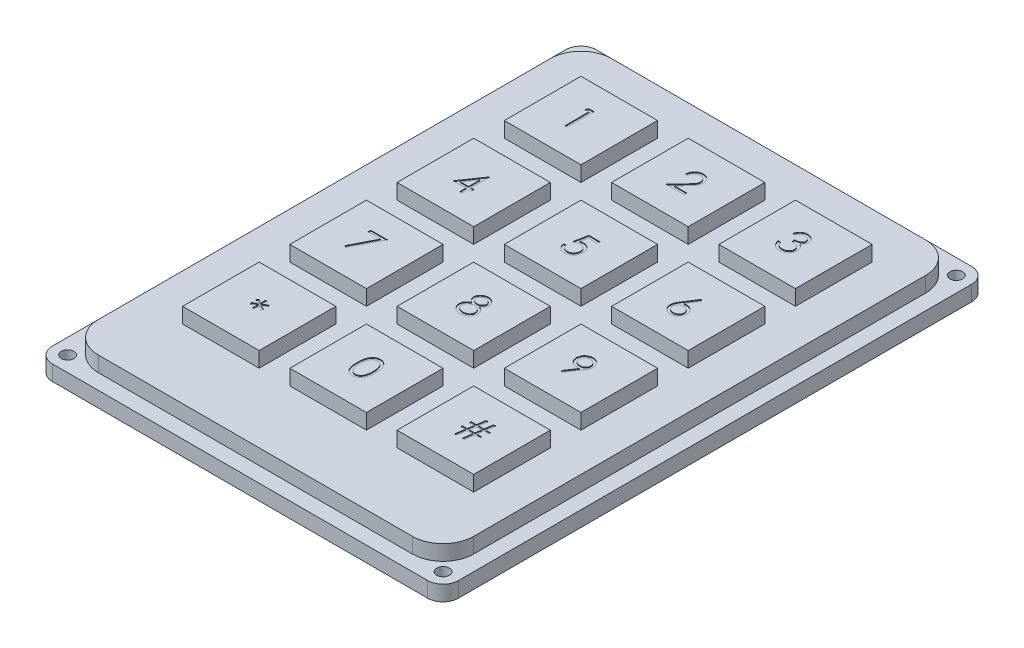
from build123d import *

# Parameters (mm, degrees)
SKETCH1_W               = 53
SKETCH1_H               = 71
BOSS_EXTRUDE1_DEPTH     = 2
FILLET1_R               = 2
SKETCH2_W               = 49
SKETCH2_H               = 67
BOSS_EXTRUDE2_DEPTH     = 2
FILLET2_R               = 4
SKETCH3_W               = 10
SKETCH3_H               = 10
KEY_DEPTH               = 2
KEYS_COUNT              = 3
KEYS_PITCH              = 14
KEYS_COUNT_DIR2         = 4
KEYS_PITCH_DIR2         = 14
SKETCH4_R               = 0.823323551
CUT_EXTRUDE1_DEPTH      = 45.480332733
MIRROR2_COPY_1_SKETCH_R = 0.823323551
MIRROR2_COPY_1_DEPTH    = 45.480332733
NUMBERS_DEPTH           = 0.1


with BuildPart() as part:
    # Sketch1 → Boss-Extrude1 (new body)
    with BuildSketch(Plane(origin=(0, 0, 0), x_dir=(1, 0, 0), z_dir=(0, 1, 0))):
        Rectangle(SKETCH1_W, SKETCH1_H)
    extrude(amount=BOSS_EXTRUDE1_DEPTH)

    # Fillet1
    fillet1_edges = [part.edges().sort_by_distance(p)[0] for p in [
        (-26.5, 1, -35.5),
        (26.5, 1, -35.5),
        (26.5, 1, 35.5),
        (-26.5, 1, 35.5),
    ]]
    fillet(fillet1_edges, radius=FILLET1_R)

    # Sketch2 → Boss-Extrude2 (add)
    with BuildSketch(Plane(origin=(0, 2, 0), x_dir=(1, 0, 0), z_dir=(0, 1, 0))):
        Rectangle(SKETCH2_W, SKETCH2_H)
    extrude(amount=BOSS_EXTRUDE2_DEPTH)

    # Fillet2
    fillet2_edges = [part.edges().sort_by_distance(p)[0] for p in [
        (24.5, 3, -33.5),
        (-24.5, 3, -33.5),
        (24.5, 3, 33.5),
        (-24.5, 3, 33.5),
    ]]
    fillet(fillet2_edges, radius=FILLET2_R)

    # Sketch3 → Key (add)
    with BuildSketch(Plane(origin=(0, 4, 0), x_dir=(1, 0, 0), z_dir=(0, 1, 0))):
        with Locations((-13.5, 22.5)):
            Rectangle(SKETCH3_W, SKETCH3_H)
    key = extrude(amount=KEY_DEPTH)

    # Keys: Key 3 × 4
    with Locations(*[(i * KEYS_PITCH, 0, j * KEYS_PITCH_DIR2) for i in range(KEYS_COUNT) for j in range(KEYS_COUNT_DIR2) if (i, j) != (0, 0)]):
        add(key)

    # Sketch4 → Cut-Extrude1 (cut, through all)
    with BuildSketch(Plane(origin=(0, 2, 0), x_dir=(1, 0, 0), z_dir=(0, 1, 0))):
        with Locations((-24.5, 33.5)):
            Circle(SKETCH4_R)
    cut_extrude1 = extrude(amount=-CUT_EXTRUDE1_DEPTH, mode=Mode.SUBTRACT)

    # Mirror1: Cut-Extrude1 across plane
    add(cut_extrude1.mirror(Plane(origin=(0, 0, 0), x_dir=(0, 0, 1), z_dir=(1, 0, 0))), mode=Mode.SUBTRACT)

    # Mirror2: Cut-Extrude1 across plane
    add(cut_extrude1.mirror(Plane.XY), mode=Mode.SUBTRACT)

    # Mirror2 copy 1 sketch → Mirror2 copy 1 (cut, through all)
    with BuildSketch(Plane(origin=(0, 2, 0), x_dir=(-1, 0, 0), z_dir=(0, 1, 0))):
        with Locations((-24.5, 33.5)):
            Circle(MIRROR2_COPY_1_SKETCH_R)
    extrude(amount=-MIRROR2_COPY_1_DEPTH, mode=Mode.SUBTRACT)

    # Sketch5 → Numbers (cut)
    # profile 1 of 12: a face of its own
    with BuildSketch(Plane(origin=(0, 6, 0), x_dir=(1, 0, 0), z_dir=(0, 1, 0))):
        Polygon((-14.289444186, 24.351344615), (-13.642308769, 24.351344615), (-13.642308769, 20.851344615), (-13.956411333, 20.851344615), (-13.956411333, 23.992370256), (-14.494872872, 23.992370256), align=None)
    # profile 2 of 12: a face of its own
    with BuildSketch(Plane(origin=(0, 6, 0), x_dir=(1, 0, 0), z_dir=(0, 1, 0))):
        with BuildLine():
            Line((-0.305734857, 23.274421538), (-0.619837421, 23.274421538))
            add(Edge.make_bspline(
                [(-0.619837421, 23.274421538), (-0.617790268, 23.316092426), (-0.613769714, 23.39793294), (-0.594941425, 23.517256847), (-0.568000547, 23.631311645), (-0.529909093, 23.739181559), (-0.482602816, 23.841820367), (-0.425872788, 23.938820382), (-0.358678938, 24.029811571), (-0.282472204, 24.113950414), (-0.199703565, 24.191137985), (-0.110397625, 24.257793228), (-0.016552598, 24.314110899), (0.081546801, 24.361192141), (0.185007365, 24.396531987), (0.292890223, 24.422753627), (0.405669359, 24.438529972), (0.482509381, 24.440225758), (0.521588861, 24.441088205)],
                knots=[0, 0, 0, 0, 1.10065271, 2.161652631, 3.183658789, 4.190468796, 5.17591951, 6.163126047, 7.15150782, 8.156236427, 9.156009102, 10.134482811, 11.092018607, 12.041330605, 13.001268258, 13.972401359, 14.968799086, 16, 16, 16, 16], degree=3))
            add(Edge.make_bspline(
                [(0.521588861, 24.441088205), (0.559966935, 24.440189748), (0.63537848, 24.438424313), (0.745440494, 24.423263284), (0.850217789, 24.399517693), (0.949505555, 24.366202276), (1.04251162, 24.321417849), (1.129934665, 24.26762031), (1.212815475, 24.205400479), (1.287422259, 24.132146665), (1.355930338, 24.053944281), (1.415032593, 23.970456377), (1.465645757, 23.884227092), (1.507833437, 23.79459889), (1.538889576, 23.700727862), (1.562467784, 23.603980659), (1.575795197, 23.503355848), (1.577840621, 23.435249292), (1.578880528, 23.400623461)],
                knots=[0, 0, 0, 0, 1.111607364, 2.184268762, 3.212621178, 4.221274766, 5.211760367, 6.196651075, 7.1921475, 8.207485113, 9.220403448, 10.201281604, 11.166441695, 12.114753415, 13.065576456, 14.026450734, 14.996634279, 16, 16, 16, 16], degree=3))
            add(Edge.make_bspline(
                [(1.578880528, 23.400623461), (1.577187265, 23.351875627), (1.573830454, 23.255235413), (1.545116077, 23.11322055), (1.500269566, 22.975627131), (1.446272209, 22.864889829), (1.391799765, 22.775656335), (1.342712258, 22.70218763), (1.285247446, 22.623082162), (1.218568949, 22.538604824), (1.144056076, 22.448093919), (1.061033913, 22.351604124), (0.968910431, 22.250132354), (0.90425193, 22.180826753), (0.870747515, 22.144914326)],
                knots=[0, 0, 0, 0, 1.184426356, 2.348067706, 3.509069118, 4.696110526, 5.333549288, 6.050745305, 6.844228056, 7.710549037, 8.667450064, 9.695053472, 10.805634456, 12, 12, 12, 12], degree=3))
            Line((0.870747515, 22.144914326), (-0.004953607, 21.210318974))
            Line((-0.004953607, 21.210318974), (1.623752323, 21.210318974))
            Line((1.623752323, 21.210318974), (1.623752323, 20.851344615))
            Line((1.623752323, 20.851344615), (-0.754452805, 20.851344615))
            Line((-0.754452805, 20.851344615), (0.602918989, 22.299862243))
            add(Edge.make_bspline(
                [(0.602918989, 22.299862243), (0.635966876, 22.33436055), (0.699445103, 22.400624736), (0.78922768, 22.497367696), (0.869866668, 22.587117237), (0.941884061, 22.669703786), (1.003717567, 22.746335353), (1.058589799, 22.814530057), (1.10255539, 22.877284507), (1.150270785, 22.950025121), (1.196484767, 23.038837438), (1.236197123, 23.147371128), (1.260411971, 23.25909838), (1.263316807, 23.334600417), (1.264777964, 23.372578589)],
                knots=[0, 0, 0, 0, 1.329631726, 2.553950428, 3.673215718, 4.687767853, 5.603093632, 6.413772471, 7.123043292, 7.734684054, 8.834405432, 9.900288307, 10.943827018, 12, 12, 12, 12], degree=3))
            add(Edge.make_bspline(
                [(1.264777964, 23.372578589), (1.264142221, 23.396459988), (1.262889295, 23.443525638), (1.251831598, 23.512531397), (1.235121092, 23.579096211), (1.211175834, 23.64342483), (1.179569094, 23.704870482), (1.141095714, 23.763507962), (1.09670565, 23.820196927), (1.045354381, 23.873350226), (0.988942861, 23.922031431), (0.929348612, 23.965155516), (0.866298507, 24.001194627), (0.800058385, 24.030738124), (0.730812916, 24.053913506), (0.658428171, 24.069972085), (0.583104154, 24.080054569), (0.531670659, 24.081418741), (0.50546306, 24.082113846)],
                knots=[0, 0, 0, 0, 0.991446411, 1.95395049, 2.89581595, 3.838931463, 4.798493298, 5.75982156, 6.748411868, 7.785213223, 8.824556874, 9.840280684, 10.836137867, 11.835679398, 12.848801643, 13.863922112, 14.911575587, 16, 16, 16, 16], degree=3))
            add(Edge.make_bspline(
                [(0.50546306, 24.082113846), (0.478092227, 24.081398813), (0.424340431, 24.079994608), (0.345421398, 24.070171944), (0.27013562, 24.053226104), (0.198293718, 24.030049429), (0.129774132, 24.000590881), (0.064910088, 23.963899136), (0.003847198, 23.920115643), (-0.053529325, 23.870475086), (-0.106393304, 23.815207485), (-0.15284018, 23.753597522), (-0.193424194, 23.686770107), (-0.228833427, 23.614905556), (-0.257589118, 23.537351776), (-0.279562268, 23.454384071), (-0.296949115, 23.36636269), (-0.302757635, 23.305577605), (-0.305734857, 23.274421538)],
                knots=[0, 0, 0, 0, 1.031018746, 2.02475058, 2.990194455, 3.934040569, 4.864654155, 5.795059489, 6.735614925, 7.690564532, 8.649604399, 9.611025574, 10.590972636, 11.591080095, 12.624614302, 13.701020113, 14.821632451, 16, 16, 16, 16], degree=3))
        make_face()
    # profile 3 of 12: a face of its own
    with BuildSketch(Plane(origin=(0, 6, 0), x_dir=(1, 0, 0), z_dir=(0, 1, 0))):
        with BuildLine():
            Line((13.410526912, 23.543652307), (13.096424348, 23.543652307))
            add(Edge.make_bspline(
                [(13.096424348, 23.543652307), (13.104933899, 23.578884791), (13.121569374, 23.647761416), (13.156266948, 23.746168676), (13.194066203, 23.839292198), (13.239455308, 23.925388272), (13.288964062, 24.006187174), (13.345686783, 24.079856299), (13.407006506, 24.148269264), (13.474831455, 24.208982502), (13.545960117, 24.263960231), (13.621394737, 24.310835288), (13.69961763, 24.351159441), (13.781170763, 24.384379673), (13.866296935, 24.409405197), (13.954226558, 24.427562002), (14.045190058, 24.439353117), (14.106937649, 24.44050388), (14.138291335, 24.441088205)],
                knots=[0, 0, 0, 0, 1.162005537, 2.271625781, 3.343758855, 4.383309926, 5.390229558, 6.379919256, 7.361854164, 8.333198761, 9.295911338, 10.242430842, 11.177959212, 12.116337295, 13.062827104, 14.020064771, 14.994644689, 16, 16, 16, 16], degree=3))
            add(Edge.make_bspline(
                [(14.138291335, 24.441088205), (14.183974077, 24.439708974), (14.274343088, 24.436980599), (14.407106135, 24.412066162), (14.535132954, 24.37264103), (14.657022202, 24.318167303), (14.770240635, 24.25097999), (14.870976822, 24.171015253), (14.957865332, 24.079815951), (15.03075971, 23.979083387), (15.087834709, 23.871427878), (15.129921083, 23.760627721), (15.155542764, 23.646945749), (15.15886332, 23.57018847), (15.160526912, 23.531733237)],
                knots=[0, 0, 0, 0, 1.083050992, 2.142477498, 3.193116406, 4.255571735, 5.30263384, 6.308962982, 7.297363603, 8.282367274, 9.249857812, 10.179914175, 11.08814088, 12, 12, 12, 12], degree=3))
            add(Edge.make_bspline(
                [(15.160526912, 23.531733237), (15.159363321, 23.494726442), (15.157086354, 23.422309888), (15.137752648, 23.31658839), (15.105216386, 23.21694679), (15.060146623, 23.122965628), (15.001805073, 23.035240788), (14.931132376, 22.953574897), (14.847629714, 22.877605739), (14.784350776, 22.834086266), (14.751772906, 22.811681153)],
                knots=[0, 0, 0, 0, 1.024540389, 2.004866551, 2.965041327, 3.920577974, 4.882998113, 5.874504559, 6.905732034, 8, 8, 8, 8], degree=3))
            add(Edge.make_bspline(
                [(14.751772906, 22.811681153), (14.78900466, 22.793702982), (14.862771535, 22.758083024), (14.963322064, 22.688227267), (15.05459994, 22.607570919), (15.105503659, 22.544628266), (15.131079797, 22.513003269)],
                knots=[0, 0, 0, 0, 1.015518401, 2.012035669, 3.001164323, 4, 4, 4, 4], degree=3))
            add(Edge.make_bspline(
                [(15.131079797, 22.513003269), (15.147921139, 22.489945517), (15.181328035, 22.444207601), (15.222563569, 22.370671175), (15.259972683, 22.296319685), (15.289122903, 22.219160279), (15.311696769, 22.140087266), (15.327832802, 22.05896487), (15.337856943, 21.975726847), (15.339292495, 21.919414367), (15.340014092, 21.891108237)],
                knots=[0, 0, 0, 0, 1.025084078, 2.033381695, 3.024893161, 4.013698104, 4.991890475, 5.976764909, 6.982997093, 8, 8, 8, 8], degree=3))
            add(Edge.make_bspline(
                [(15.340014092, 21.891108237), (15.338219578, 21.842098516), (15.334638996, 21.744309714), (15.302634922, 21.599834992), (15.253021681, 21.45860949), (15.182564745, 21.323534651), (15.096697236, 21.19715427), (14.994539912, 21.084077961), (14.877253504, 20.986879356), (14.746447855, 20.905669128), (14.604730726, 20.840751206), (14.453155134, 20.795693763), (14.29390508, 20.766347763), (14.184697783, 20.763200895), (14.129176752, 20.761601025)],
                knots=[0, 0, 0, 0, 0.955779014, 1.907060117, 2.875433937, 3.871313158, 4.872415639, 5.851225146, 6.836215519, 7.83643374, 8.849228613, 9.86973379, 10.916971861, 12, 12, 12, 12], degree=3))
            add(Edge.make_bspline(
                [(14.129176752, 20.761601025), (14.091757452, 20.762469238), (14.018128747, 20.764177593), (13.909885248, 20.775856194), (13.806563549, 20.797186199), (13.708023951, 20.825889504), (13.614178915, 20.862281247), (13.525314809, 20.907599945), (13.440884916, 20.960911447), (13.361685965, 21.022845034), (13.287727397, 21.092126374), (13.220974673, 21.169985384), (13.16031488, 21.254982788), (13.107372241, 21.348105844), (13.059735289, 21.448151102), (13.020554332, 21.5563996), (12.986068763, 21.671883622), (12.970035299, 21.752361362), (12.961808964, 21.793652307)],
                knots=[0, 0, 0, 0, 1.048658725, 2.063410685, 3.046034179, 4.001477787, 4.936774919, 5.862367409, 6.792675028, 7.730719943, 8.675894397, 9.627829632, 10.600096036, 11.597688215, 12.626045268, 13.701542398, 14.82072376, 16, 16, 16, 16], degree=3))
            Line((12.961808964, 21.793652307), (13.275911528, 21.793652307))
            add(Edge.make_bspline(
                [(13.275911528, 21.793652307), (13.284094819, 21.766703294), (13.300012032, 21.714285122), (13.32710633, 21.638844817), (13.357974602, 21.569686763), (13.39108916, 21.506303641), (13.425867606, 21.448071239), (13.464782532, 21.39652937), (13.504951677, 21.349414168), (13.53523103, 21.322869556), (13.550050149, 21.309878269)],
                knots=[0, 0, 0, 0, 1.198163088, 2.33053128, 3.407730985, 4.417276592, 5.372219308, 6.28897303, 7.162600585, 8, 8, 8, 8], degree=3))
            add(Edge.make_bspline(
                [(13.550050149, 21.309878269), (13.569646726, 21.294769935), (13.608779389, 21.264599903), (13.67254762, 21.226098275), (13.739612506, 21.192737249), (13.81142718, 21.167253554), (13.886441951, 21.145675893), (13.965869316, 21.131555374), (14.049008533, 21.121867202), (14.105776296, 21.121012271), (14.134785726, 21.120575384)],
                knots=[0, 0, 0, 0, 0.946170439, 1.889420265, 2.845303464, 3.807233317, 4.801018734, 5.828864929, 6.890507805, 8, 8, 8, 8], degree=3))
            add(Edge.make_bspline(
                [(14.134785726, 21.120575384), (14.167539229, 21.121191289), (14.231585876, 21.122395639), (14.325040735, 21.133471346), (14.413948183, 21.149601759), (14.497321109, 21.174514742), (14.576251616, 21.205295594), (14.649633266, 21.243943999), (14.718429372, 21.289288721), (14.781758777, 21.340827879), (14.838704285, 21.397249374), (14.888843798, 21.456262445), (14.931468459, 21.517618275), (14.965852038, 21.581656396), (14.993002588, 21.648111625), (15.011485788, 21.717170454), (15.024337304, 21.78826772), (15.025383916, 21.836596689), (15.025911528, 21.86096)],
                knots=[0, 0, 0, 0, 1.217147791, 2.380027433, 3.494444702, 4.572153297, 5.609568379, 6.639424714, 7.649109417, 8.668170816, 9.669597737, 10.625200337, 11.543417969, 12.441394052, 13.322311151, 14.205496177, 15.095365482, 16, 16, 16, 16], degree=3))
            add(Edge.make_bspline(
                [(15.025911528, 21.86096), (15.024381226, 21.893571338), (15.021328238, 21.958631747), (14.998019658, 22.054349321), (14.959680794, 22.146572733), (14.906008283, 22.233728523), (14.840672554, 22.314504425), (14.764307647, 22.386575907), (14.676279419, 22.446045999), (14.59525955, 22.487134655), (14.523494393, 22.51517173), (14.462079009, 22.533846695), (14.393322405, 22.54966035), (14.318056057, 22.564372622), (14.23571284, 22.57689397), (14.146382402, 22.587335786), (14.05004664, 22.595690827), (13.983355475, 22.599421922), (13.948988451, 22.601344615)],
                knots=[0, 0, 0, 0, 1.07054697, 2.135767047, 3.216561865, 4.33974944, 5.486079747, 6.621378074, 7.775625952, 8.963672916, 9.598146892, 10.304877434, 11.070270905, 11.915000392, 12.823868403, 13.805723172, 14.86925407, 16, 16, 16, 16], degree=3))
            Line((13.948988451, 22.601344615), (13.948988451, 22.960318974))
            add(Edge.make_bspline(
                [(13.948988451, 22.960318974), (13.992289616, 22.961053778), (14.077105963, 22.962493078), (14.201000268, 22.979901088), (14.31947358, 23.003981716), (14.429900322, 23.040866908), (14.530549035, 23.083707205), (14.617868637, 23.133559415), (14.690635785, 23.188974164), (14.748496856, 23.250806773), (14.792026085, 23.317121821), (14.823852882, 23.386238478), (14.842653208, 23.458762539), (14.845162875, 23.508257207), (14.846424348, 23.53313548)],
                knots=[0, 0, 0, 0, 1.321986639, 2.589447074, 3.816329219, 5.01088745, 6.139805852, 7.153945165, 8.075214402, 8.924034688, 9.728124013, 10.488707548, 11.240355623, 12, 12, 12, 12], degree=3))
            add(Edge.make_bspline(
                [(14.846424348, 23.53313548), (14.846009937, 23.551413225), (14.845185486, 23.587775933), (14.834788208, 23.640901001), (14.819164167, 23.692401947), (14.797684438, 23.742059757), (14.768934239, 23.789530031), (14.734528253, 23.83521748), (14.693560153, 23.878861259), (14.646614706, 23.919541579), (14.596202901, 23.958310816), (14.540953126, 23.991224453), (14.482531251, 24.019369515), (14.420872596, 24.042579017), (14.355777066, 24.060038305), (14.287550508, 24.072574147), (14.216062825, 24.080411802), (14.167291093, 24.081540217), (14.142498066, 24.082113846)],
                knots=[0, 0, 0, 0, 0.884392785, 1.759457502, 2.611959086, 3.489218968, 4.37281399, 5.2945488, 6.255912374, 7.266815255, 8.301784654, 9.332968512, 10.37626691, 11.440494194, 12.520033166, 13.637162961, 14.798855837, 16, 16, 16, 16], degree=3))
            add(Edge.make_bspline(
                [(14.142498066, 24.082113846), (14.102646398, 24.080722484), (14.024806822, 24.07800483), (13.912591905, 24.054201817), (13.808272571, 24.016223733), (13.728533904, 23.970890714), (13.66965133, 23.92614028), (13.627574392, 23.887057894), (13.586253881, 23.84362507), (13.548408205, 23.793166695), (13.510134228, 23.739099904), (13.475289666, 23.678676223), (13.441429974, 23.613471829), (13.421027424, 23.567376194), (13.410526912, 23.543652307)],
                knots=[0, 0, 0, 0, 1.472543308, 2.876219568, 4.221790263, 5.565193594, 6.249813518, 6.953379497, 7.687249741, 8.463570142, 9.283606569, 10.136032583, 11.040678096, 12, 12, 12, 12], degree=3))
        make_face()
    # profile 4 of 12: a face of its own
    with BuildSketch(Plane(origin=(0, 6, 0), x_dir=(1, 0, 0), z_dir=(0, 1, 0))):
        Polygon((-13.122777519, 10.130049298), (-13.058975436, 10.130049298), (-13.058975436, 7.706972375), (-12.655129282, 7.706972375), (-12.655129282, 7.347998016), (-13.058975436, 7.347998016), (-13.058975436, 6.540305708), (-13.373078, 6.540305708), (-13.373078, 7.347998016), (-15.03333441, 7.347998016), align=None)
        Polygon((-13.373078, 7.706972375), (-13.373078, 9.227004426), (-14.416347231, 7.706972375), align=None, mode=Mode.SUBTRACT)
    # profile 5 of 12: a face of its own
    with BuildSketch(Plane(origin=(0, 6, 0), x_dir=(1, 0, 0), z_dir=(0, 1, 0))):
        with BuildLine():
            Line((1.444265143, 10.040305708), (1.444265143, 9.681331349))
            Line((1.444265143, 9.681331349), (0.253760336, 9.681331349))
            Line((0.253760336, 9.681331349), (0.065158573, 8.760758432))
            add(Edge.make_bspline(
                [(0.065158573, 8.760758432), (0.102214447, 8.770988704), (0.174004343, 8.790808238), (0.279964204, 8.812814008), (0.380556407, 8.826079452), (0.445831778, 8.827890763), (0.477418188, 8.828767246)],
                knots=[0, 0, 0, 0, 1.100273476, 2.13160584, 3.095893838, 4, 4, 4, 4], degree=3))
            add(Edge.make_bspline(
                [(0.477418188, 8.828767246), (0.516501928, 8.827921311), (0.593350325, 8.82625799), (0.705789272, 8.81028614), (0.813122165, 8.785146226), (0.915124536, 8.750025704), (1.011985086, 8.705115971), (1.102812648, 8.64901603), (1.188970561, 8.583482699), (1.268913155, 8.508137687), (1.341437463, 8.425216071), (1.405203452, 8.3360582), (1.459366043, 8.241530537), (1.502926798, 8.140729929), (1.537711132, 8.034770775), (1.560863127, 7.922538193), (1.576279836, 7.805090073), (1.578002222, 7.724785503), (1.578880528, 7.683835355)],
                knots=[0, 0, 0, 0, 1.052922333, 2.070308379, 3.05430497, 4.020497103, 4.973039431, 5.925935799, 6.892292201, 7.88610001, 8.88166317, 9.857072816, 10.836096531, 11.812156883, 12.81219415, 13.836441305, 14.89672472, 16, 16, 16, 16], degree=3))
            add(Edge.make_bspline(
                [(1.578880528, 7.683835355), (1.578215453, 7.655313135), (1.57689429, 7.598654148), (1.570175702, 7.514509947), (1.557239986, 7.432147114), (1.539872262, 7.351554722), (1.517329844, 7.27288535), (1.49004079, 7.195913822), (1.456644763, 7.121119215), (1.420013388, 7.04779382), (1.378766909, 6.977595313), (1.332988402, 6.911946326), (1.284622911, 6.849862045), (1.232581525, 6.792008312), (1.17638053, 6.738765294), (1.116700563, 6.689817012), (1.054017844, 6.644335682), (0.987362602, 6.604167487), (0.918220119, 6.567204531), (0.845591902, 6.536880993), (0.771131202, 6.509770465), (0.693766326, 6.488160938), (0.613672513, 6.471228383), (0.530717738, 6.459727783), (0.445337068, 6.451351345), (0.387462055, 6.450826988), (0.358227483, 6.450562118)],
                knots=[0, 0, 0, 0, 1.056347294, 2.098418968, 3.122841568, 4.141288669, 5.149314143, 6.15115421, 7.162517403, 8.180376062, 9.185164535, 10.17417709, 11.141909838, 12.097768115, 13.052685741, 14.0056014, 14.954263652, 15.917497458, 16.885230207, 17.854509472, 18.828990115, 19.81800267, 20.826176721, 21.857883937, 22.917946725, 24, 24, 24, 24], degree=3))
            add(Edge.make_bspline(
                [(0.358227483, 6.450562118), (0.323353302, 6.451252956), (0.254742472, 6.452612098), (0.154221905, 6.466830584), (0.057507299, 6.4871945), (-0.034622802, 6.51783077), (-0.122994066, 6.556218065), (-0.206416784, 6.604734236), (-0.28702256, 6.65971334), (-0.361534597, 6.724593693), (-0.43069071, 6.795509375), (-0.492597219, 6.872467016), (-0.547730796, 6.954196458), (-0.595208543, 7.041094612), (-0.635706564, 7.132933143), (-0.667521552, 7.230056144), (-0.693199907, 7.331956148), (-0.704063328, 7.402109658), (-0.709581011, 7.437741605)],
                knots=[0, 0, 0, 0, 1.0467383, 2.05933395, 3.04377827, 4.011590433, 4.970194871, 5.932262533, 6.905835911, 7.896367577, 8.894135286, 9.877477877, 10.858688626, 11.851381753, 12.8477658, 13.868841284, 14.917554742, 16, 16, 16, 16], degree=3))
            Line((-0.709581011, 7.437741605), (-0.395478446, 7.437741605))
            add(Edge.make_bspline(
                [(-0.395478446, 7.437741605), (-0.387749889, 7.404365153), (-0.372895173, 7.340213758), (-0.340289424, 7.250082417), (-0.300423548, 7.169763193), (-0.2530192, 7.09819361), (-0.19646917, 7.035784613), (-0.131939741, 6.980167551), (-0.059592017, 6.929992421), (0.020801212, 6.888169654), (0.105614291, 6.852500901), (0.194381501, 6.828749206), (0.284685848, 6.812048313), (0.345764218, 6.810376552), (0.37645665, 6.809536477)],
                knots=[0, 0, 0, 0, 1.136247022, 2.183929868, 3.172523383, 4.106158343, 5.02341133, 5.958108904, 6.928429099, 7.938127109, 8.96079061, 9.975095812, 10.982467395, 12, 12, 12, 12], degree=3))
            add(Edge.make_bspline(
                [(0.37645665, 6.809536477), (0.406415094, 6.810357255), (0.465403516, 6.811973374), (0.552214903, 6.824412386), (0.636027777, 6.843569957), (0.716015134, 6.872239812), (0.793576674, 6.90708453), (0.866750444, 6.951799606), (0.937653321, 7.003259625), (1.004081455, 7.062216255), (1.064920904, 7.127185949), (1.118677025, 7.196663343), (1.163453938, 7.270780189), (1.201188047, 7.348253342), (1.229841346, 7.429931899), (1.250282327, 7.515433074), (1.262285386, 7.604968055), (1.263936566, 7.666037364), (1.264777964, 7.69715667)],
                knots=[0, 0, 0, 0, 1.027316725, 2.022795036, 3.002884548, 3.971462791, 4.93288096, 5.914575861, 6.907176829, 7.935150275, 8.956128384, 9.956726525, 10.942570165, 11.921478529, 12.907843606, 13.90538589, 14.932640048, 16, 16, 16, 16], degree=3))
            add(Edge.make_bspline(
                [(1.264777964, 7.69715667), (1.264119484, 7.725232421), (1.262830604, 7.78018671), (1.252300034, 7.860585917), (1.233983062, 7.936658959), (1.208559182, 8.008773193), (1.176279674, 8.076996635), (1.136833362, 8.141399695), (1.089479964, 8.201133529), (1.035388075, 8.256226082), (0.976130034, 8.307070957), (0.910686292, 8.350415044), (0.840426365, 8.386878961), (0.766196765, 8.41834696), (0.686231867, 8.440947705), (0.602115234, 8.45791559), (0.512938527, 8.467730953), (0.451967838, 8.469092842), (0.420627323, 8.469792887)],
                knots=[0, 0, 0, 0, 1.045622112, 2.046656509, 3.013763289, 3.955457236, 4.890082067, 5.820317437, 6.762574623, 7.722996705, 8.69280354, 9.665887285, 10.63943826, 11.638615906, 12.663482002, 13.728887084, 14.832589034, 16, 16, 16, 16], degree=3))
            add(Edge.make_bspline(
                [(0.420627323, 8.469792887), (0.393498394, 8.469212296), (0.337484039, 8.468013523), (0.251561212, 8.459187026), (0.161269489, 8.444947732), (0.066954993, 8.425361484), (-0.031665515, 8.399730407), (-0.134383915, 8.369015907), (-0.241416182, 8.332293908), (-0.313533906, 8.304561694), (-0.350606652, 8.290305708)],
                knots=[0, 0, 0, 0, 0.817624296, 1.688186739, 2.600797293, 3.572016777, 4.590301741, 5.671205678, 6.80286297, 8, 8, 8, 8], degree=3))
            Line((-0.350606652, 8.290305708), (0.008367707, 10.040305708))
            Line((0.008367707, 10.040305708), (1.444265143, 10.040305708))
        make_face()
    # profile 6 of 12: a face of its own
    with BuildSketch(Plane(origin=(0, 6, 0), x_dir=(1, 0, 0), z_dir=(0, 1, 0))):
        with BuildLine():
            Line((14.577193579, 10.130049298), (14.819080598, 9.940045291))
            Line((14.819080598, 9.940045291), (13.894300951, 8.525882631))
            add(Edge.make_bspline(
                [(13.894300951, 8.525882631), (13.955871228, 8.535696492), (14.075971014, 8.554839537), (14.197536913, 8.557997482), (14.256780919, 8.559536477)],
                knots=[0, 0, 0, 0, 1.025318673, 2, 2, 2, 2], degree=3))
            add(Edge.make_bspline(
                [(14.256780919, 8.559536477), (14.292353415, 8.558580366), (14.362376815, 8.556698288), (14.465183618, 8.542214437), (14.563972554, 8.519389326), (14.658334166, 8.48611707), (14.748607148, 8.443614715), (14.835309544, 8.392675845), (14.916811554, 8.330670165), (14.994162733, 8.261405209), (15.064389831, 8.184688224), (15.126565886, 8.103286888), (15.178792678, 8.017286007), (15.221166599, 7.926729141), (15.254071478, 7.831755881), (15.278059123, 7.732487742), (15.292238716, 7.62885627), (15.294164207, 7.558378095), (15.295142297, 7.522577343)],
                knots=[0, 0, 0, 0, 1.04369286, 2.054478336, 3.041073146, 4.015093852, 4.984733326, 5.965804835, 6.960378782, 7.985147595, 9.009457201, 10.008161701, 10.986880575, 11.956520048, 12.937015923, 13.931873656, 14.949455224, 16, 16, 16, 16], degree=3))
            add(Edge.make_bspline(
                [(15.295142297, 7.522577343), (15.293719192, 7.473597639), (15.290918858, 7.377217173), (15.263015062, 7.236840466), (15.219655418, 7.103107951), (15.157677889, 6.978154779), (15.080695506, 6.86215221), (14.986817913, 6.759366744), (14.879374425, 6.667696707), (14.757887627, 6.591040088), (14.627144663, 6.528437037), (14.489792665, 6.483471795), (14.347165519, 6.455788325), (14.250360911, 6.452317723), (14.201392297, 6.450562118)],
                knots=[0, 0, 0, 0, 1.031375318, 2.029502543, 3.004789286, 3.987476834, 4.960371455, 5.9300674, 6.912260825, 7.929083631, 8.949397511, 9.960523116, 10.96833055, 12, 12, 12, 12], degree=3))
            add(Edge.make_bspline(
                [(14.201392297, 6.450562118), (14.154295596, 6.452090324), (14.061005278, 6.455117432), (13.923772484, 6.48208337), (13.791909467, 6.525790473), (13.666340086, 6.586004751), (13.550019473, 6.662062634), (13.445953836, 6.753624913), (13.354662062, 6.858734378), (13.278687441, 6.977374726), (13.218428709, 7.104864683), (13.173238784, 7.23780184), (13.146842541, 7.375701821), (13.143153984, 7.46918296), (13.141296143, 7.516267246)],
                knots=[0, 0, 0, 0, 1.012016664, 2.004627821, 2.994792927, 3.992885782, 4.990978636, 5.973936114, 6.964471063, 7.975201453, 8.993600317, 9.990122807, 10.98767138, 12, 12, 12, 12], degree=3))
            add(Edge.make_bspline(
                [(13.141296143, 7.516267246), (13.142477588, 7.55231183), (13.144889873, 7.625907982), (13.161733263, 7.73737201), (13.188798058, 7.851423091), (13.219108304, 7.948177285), (13.251133914, 8.027438807), (13.277786454, 8.091342298), (13.31096045, 8.157103371), (13.346333831, 8.226977007), (13.3870907, 8.299162439), (13.43140635, 8.374866109), (13.480506001, 8.452884037), (13.514926163, 8.505828232), (13.532522105, 8.532893849)],
                knots=[0, 0, 0, 0, 1.173818275, 2.396712641, 3.66331629, 4.989737886, 5.693666774, 6.447286557, 7.243889047, 8.091586357, 8.998013824, 9.943181721, 10.948533338, 12, 12, 12, 12], degree=3))
            Line((13.532522105, 8.532893849), (14.577193579, 10.130049298))
        make_face()
        with BuildLine():
            add(Edge.make_bspline(
                [(14.19087547, 8.200562118), (14.164213225, 8.199784075), (14.112134116, 8.198264329), (14.035726701, 8.189439077), (13.96341345, 8.172820012), (13.894236316, 8.15165368), (13.829488613, 8.12255062), (13.768699773, 8.087198821), (13.711634721, 8.045577643), (13.658891169, 7.998276732), (13.611071506, 7.946488699), (13.569890375, 7.891019177), (13.534367975, 7.833204974), (13.505486156, 7.772563031), (13.482996081, 7.709116532), (13.46672783, 7.643157282), (13.457674079, 7.574242976), (13.456167847, 7.527510474), (13.455398707, 7.503647054)],
                knots=[0, 0, 0, 0, 1.129588631, 2.206414736, 3.251139165, 4.268635594, 5.265702196, 6.250456724, 7.242448911, 8.251968645, 9.246821453, 10.222880186, 11.173611482, 12.116736599, 13.062300278, 14.020270554, 14.989073742, 16, 16, 16, 16], degree=3))
            add(Edge.make_bspline(
                [(13.455398707, 7.503647054), (13.456025069, 7.479997074), (13.45725327, 7.433622985), (13.46840559, 7.365283805), (13.485440672, 7.299518897), (13.510781068, 7.236667298), (13.541007956, 7.17577098), (13.580913281, 7.119035694), (13.625130066, 7.063015624), (13.677984, 7.012014153), (13.734707363, 6.964557529), (13.795308565, 6.923077275), (13.858468525, 6.887591102), (13.925039947, 6.859780004), (13.994078331, 6.836955717), (14.066158885, 6.820894238), (14.141331741, 6.811813712), (14.192253679, 6.810305518), (14.21821922, 6.809536477)],
                knots=[0, 0, 0, 0, 0.989467248, 1.94019797, 2.891935182, 3.827694429, 4.772920941, 5.730924762, 6.725747692, 7.756678648, 8.79901574, 9.819492441, 10.826891316, 11.826466727, 12.835195252, 13.867842842, 14.912794438, 16, 16, 16, 16], degree=3))
            add(Edge.make_bspline(
                [(14.21821922, 6.809536477), (14.244184718, 6.810305579), (14.295106573, 6.81181389), (14.370280033, 6.820893559), (14.442358352, 6.836958207), (14.51140486, 6.859770978), (14.577946292, 6.887624587), (14.641051013, 6.922856507), (14.701079107, 6.964812625), (14.757839706, 7.011933053), (14.810473644, 7.063305905), (14.855750923, 7.118535627), (14.894434157, 7.176229523), (14.925868344, 7.236427412), (14.950929635, 7.2995569), (14.968051102, 7.365273624), (14.979180391, 7.43362565), (14.980411757, 7.479997974), (14.981039733, 7.503647054)],
                knots=[0, 0, 0, 0, 1.087397944, 2.132534446, 3.165364764, 4.174271784, 5.174024072, 6.181601208, 7.194203697, 8.236725232, 9.267838612, 10.269026844, 11.221737037, 12.171628256, 13.107553087, 14.05945871, 15.010357665, 16, 16, 16, 16], degree=3))
            add(Edge.make_bspline(
                [(14.981039733, 7.503647054), (14.98048944, 7.527541605), (14.979409394, 7.574438838), (14.967193445, 7.643126456), (14.950251071, 7.709451662), (14.92466804, 7.772997611), (14.891431496, 7.833513538), (14.850948089, 7.891305139), (14.804115518, 7.946815487), (14.750017979, 7.998378295), (14.691127745, 8.045525373), (14.628512159, 8.087144929), (14.563004186, 8.122269906), (14.494670243, 8.151577008), (14.422727361, 8.172726482), (14.348337021, 8.189379725), (14.270547779, 8.198241743), (14.21777117, 8.199778808), (14.19087547, 8.200562118)],
                knots=[0, 0, 0, 0, 0.978206639, 1.919901502, 2.851605144, 3.780102724, 4.718870031, 5.675451981, 6.667674623, 7.690630536, 8.733308323, 9.756129687, 10.767539656, 11.776269907, 12.797430371, 13.836405707, 14.897401972, 16, 16, 16, 16], degree=3))
        make_face(mode=Mode.SUBTRACT)
    # profile 7 of 12: a face of its own
    with BuildSketch(Plane(origin=(0, 6, 0), x_dir=(1, 0, 0), z_dir=(0, 1, 0))):
        Polygon((-14.808975436, -3.613546793), (-12.655129282, -3.613546793), (-14.494872872, -7.203290383), (-14.766207006, -7.053951441), (-13.186579603, -3.972521152), (-14.808975436, -3.972521152), align=None)
    # profile 8 of 12: a face of its own
    with BuildSketch(Plane(origin=(0, 6, 0), x_dir=(1, 0, 0), z_dir=(0, 1, 0))):
        with BuildLine():
            add(Edge.make_bspline(
                [(0.947169791, -5.163727082), (0.975818338, -5.178665037), (1.031692572, -5.20779904), (1.111269781, -5.254709868), (1.183994782, -5.304150833), (1.251885344, -5.353786692), (1.313748695, -5.405518344), (1.368893107, -5.4595515), (1.418680727, -5.514537445), (1.462107511, -5.571407285), (1.500304348, -5.630009935), (1.533316483, -5.690499208), (1.561533686, -5.752742541), (1.583896625, -5.817419371), (1.602318416, -5.883579633), (1.614994021, -5.952077615), (1.621810939, -6.022461956), (1.623099753, -6.070030257), (1.623752323, -6.094115703)],
                knots=[0, 0, 0, 0, 1.272397273, 2.481599622, 3.635517121, 4.734568067, 5.792894095, 6.808321871, 7.773003508, 8.711915296, 9.623354172, 10.525449501, 11.423591555, 12.311487226, 13.218079475, 14.126165749, 15.051214107, 16, 16, 16, 16], degree=3))
            add(Edge.make_bspline(
                [(1.623752323, -6.094115703), (1.622980902, -6.127813436), (1.621453972, -6.194513893), (1.608153987, -6.292960004), (1.588241009, -6.388571786), (1.559161497, -6.481328277), (1.521448106, -6.57071765), (1.47497127, -6.656816424), (1.422360065, -6.741035733), (1.380107826, -6.792855135), (1.358728284, -6.819075639)],
                knots=[0, 0, 0, 0, 1.025265484, 2.029385089, 3.018602448, 3.995076438, 4.983346944, 5.966715145, 6.97116228, 8, 8, 8, 8], degree=3))
            add(Edge.make_bspline(
                [(1.358728284, -6.819075639), (1.33089181, -6.849669413), (1.275562844, -6.910478906), (1.180779917, -6.989429716), (1.076758033, -7.05577911), (0.9638997, -7.109851005), (0.842506599, -7.151936864), (0.712604594, -7.182179382), (0.573940441, -7.199501811), (0.47863497, -7.2020058), (0.429741906, -7.203290383)],
                knots=[0, 0, 0, 0, 0.954267603, 1.896743057, 2.838368354, 3.796610408, 4.779680527, 5.799409237, 6.871065594, 8, 8, 8, 8], degree=3))
            add(Edge.make_bspline(
                [(0.429741906, -7.203290383), (0.382728517, -7.202137905), (0.291245238, -7.1998953), (0.158087361, -7.184700868), (0.033964291, -7.158073002), (-0.081845677, -7.121628392), (-0.188644371, -7.074218164), (-0.286127472, -7.015209755), (-0.375701444, -6.946978313), (-0.454647918, -6.867564235), (-0.524736361, -6.782506363), (-0.586304414, -6.694754753), (-0.637478493, -6.604301395), (-0.680805588, -6.512495028), (-0.713973611, -6.418048874), (-0.736945821, -6.321448861), (-0.751535135, -6.222863718), (-0.75347627, -6.156332065), (-0.754452805, -6.122861697)],
                knots=[0, 0, 0, 0, 1.256902934, 2.445805442, 3.576955095, 4.645999104, 5.686449165, 6.692658513, 7.68621702, 8.689161843, 9.678783111, 10.630372946, 11.551080876, 12.453998257, 13.34127905, 14.221779781, 15.105423033, 16, 16, 16, 16], degree=3))
            add(Edge.make_bspline(
                [(-0.754452805, -6.122861697), (-0.753874924, -6.098302505), (-0.752732828, -6.049764873), (-0.744827979, -5.978055545), (-0.732119518, -5.90825941), (-0.714860061, -5.840118666), (-0.691469035, -5.774129394), (-0.663226902, -5.70997892), (-0.630294949, -5.647594821), (-0.592213784, -5.58663594), (-0.54791176, -5.527956428), (-0.49774811, -5.470560433), (-0.440720242, -5.415338566), (-0.377462583, -5.361616141), (-0.308698043, -5.308440167), (-0.232640513, -5.258684439), (-0.151306245, -5.208826474), (-0.093500839, -5.179018149), (-0.063847838, -5.163727082)],
                knots=[0, 0, 0, 0, 0.941657376, 1.861047343, 2.762797495, 3.66048619, 4.553285746, 5.444104102, 6.34607688, 7.256116206, 8.197091036, 9.162375105, 10.176350973, 11.237807142, 12.343728897, 13.50695164, 14.721116704, 16, 16, 16, 16], degree=3))
            add(Edge.make_bspline(
                [(-0.063847838, -5.163727082), (-0.104439212, -5.141592313), (-0.183035475, -5.098733205), (-0.287104916, -5.019986399), (-0.37649554, -4.934698584), (-0.448750257, -4.84106879), (-0.505622485, -4.742021915), (-0.54464109, -4.638177663), (-0.571037574, -4.531461549), (-0.573652401, -4.458555353), (-0.574965626, -4.421940223)],
                knots=[0, 0, 0, 0, 1.166880483, 2.259407225, 3.286803203, 4.280235371, 5.237608625, 6.161067461, 7.076446754, 8, 8, 8, 8], degree=3))
            add(Edge.make_bspline(
                [(-0.574965626, -4.421940223), (-0.573330202, -4.384642664), (-0.570042714, -4.309668067), (-0.543459394, -4.198061944), (-0.500139327, -4.088445379), (-0.44121833, -3.981349666), (-0.367831114, -3.880399451), (-0.279784568, -3.789858505), (-0.179181271, -3.710547023), (-0.066523404, -3.64397085), (0.054712831, -3.589787191), (0.182628555, -3.552408768), (0.314995048, -3.527972652), (0.405092768, -3.525205997), (0.45077556, -3.523803203)],
                knots=[0, 0, 0, 0, 0.888701115, 1.786444228, 2.72001202, 3.692817113, 4.693886446, 5.687152267, 6.695133018, 7.739871481, 8.800368666, 9.853104506, 10.91144658, 12, 12, 12, 12], degree=3))
            add(Edge.make_bspline(
                [(0.45077556, -3.523803203), (0.495279375, -3.525249546), (0.583035828, -3.52810157), (0.712030456, -3.551888448), (0.835455333, -3.591617968), (0.952884832, -3.645515191), (1.062216699, -3.711902132), (1.158819009, -3.792303006), (1.244151591, -3.882444557), (1.314735985, -3.98336416), (1.372898874, -4.090048354), (1.413399775, -4.201670875), (1.439351749, -4.315819934), (1.442625114, -4.393057938), (1.444265143, -4.431755928)],
                knots=[0, 0, 0, 0, 1.072916533, 2.115669174, 3.151510826, 4.193348718, 5.225979165, 6.227137561, 7.216255879, 8.211077061, 9.189680878, 10.138522389, 11.067357538, 12, 12, 12, 12], degree=3))
            add(Edge.make_bspline(
                [(1.444265143, -4.431755928), (1.442830583, -4.469732592), (1.440013187, -4.544316601), (1.416313248, -4.653043121), (1.376399934, -4.75486516), (1.321905771, -4.850938112), (1.250880283, -4.93951961), (1.16427155, -5.02173608), (1.062770072, -5.098262908), (0.986509186, -5.141449273), (0.947169791, -5.163727082)],
                knots=[0, 0, 0, 0, 0.975232327, 1.915300861, 2.843280834, 3.77672583, 4.742871857, 5.749627742, 6.839139064, 8, 8, 8, 8], degree=3))
        make_face()
        with BuildLine():
            add(Edge.make_bspline(
                [(0.433247515, -3.882777562), (0.408696709, -3.883429003), (0.360664598, -3.884703505), (0.290235927, -3.891362142), (0.22326356, -3.904315359), (0.159047759, -3.921554071), (0.098468947, -3.944842059), (0.040704392, -3.972237068), (-0.013262798, -4.005543134), (-0.064084101, -4.042904332), (-0.109834875, -4.083997238), (-0.150439427, -4.126810956), (-0.184167541, -4.172186348), (-0.21280865, -4.218994708), (-0.233590168, -4.268625284), (-0.249154472, -4.319556461), (-0.259675863, -4.372431845), (-0.260464253, -4.408568355), (-0.260863062, -4.426848075)],
                knots=[0, 0, 0, 0, 1.203892937, 2.355340988, 3.463153438, 4.544400666, 5.610487187, 6.640501085, 7.674077295, 8.714426146, 9.728707835, 10.68524104, 11.601827946, 12.495867327, 13.368432065, 14.231010473, 15.105153427, 16, 16, 16, 16], degree=3))
            add(Edge.make_bspline(
                [(-0.260863062, -4.426848075), (-0.260175695, -4.445128585), (-0.258817359, -4.481253498), (-0.248312231, -4.534599364), (-0.232655376, -4.587021), (-0.208004715, -4.637271911), (-0.178438357, -4.687095271), (-0.141946881, -4.735245857), (-0.098457853, -4.781891241), (-0.049430412, -4.826634683), (0.003981125, -4.868533446), (0.060565169, -4.904906627), (0.11961156, -4.935340738), (0.180513629, -4.960670143), (0.243892077, -4.98036008), (0.30935855, -4.994328726), (0.376924052, -5.003010723), (0.422704633, -5.004047744), (0.445867707, -5.004572434)],
                knots=[0, 0, 0, 0, 0.873023192, 1.725219244, 2.590779336, 3.480155217, 4.391973325, 5.357036234, 6.360879153, 7.436073238, 8.526419356, 9.601555421, 10.645666583, 11.697338044, 12.750135903, 13.812665442, 14.89329948, 16, 16, 16, 16], degree=3))
            add(Edge.make_bspline(
                [(0.445867707, -5.004572434), (0.475617811, -5.003699567), (0.534824179, -5.001962454), (0.62210351, -4.98581128), (0.706966155, -4.960405362), (0.788505059, -4.925645396), (0.864609644, -4.882017536), (0.932449713, -4.829784518), (0.991446606, -4.770152421), (1.040987216, -4.704049585), (1.079397062, -4.633697997), (1.10929887, -4.563097704), (1.126760085, -4.491495473), (1.129037652, -4.443528509), (1.130162579, -4.419836857)],
                knots=[0, 0, 0, 0, 1.076279235, 2.141928126, 3.20205304, 4.278698113, 5.344010996, 6.36967002, 7.368914609, 8.37248503, 9.349703398, 10.264243087, 11.142681841, 12, 12, 12, 12], degree=3))
            add(Edge.make_bspline(
                [(1.130162579, -4.419836857), (1.129630682, -4.403208821), (1.128574941, -4.370204553), (1.119874885, -4.321466188), (1.105499052, -4.273836604), (1.086035972, -4.226922334), (1.060426177, -4.181381602), (1.03006199, -4.136498514), (0.993177488, -4.09328275), (0.951781055, -4.050727201), (0.904835646, -4.011343178), (0.852431734, -3.976708467), (0.794837984, -3.947296111), (0.732053034, -3.923407356), (0.66430811, -3.905465006), (0.591915235, -3.892028659), (0.514270788, -3.884455547), (0.460841037, -3.883349022), (0.433247515, -3.882777562)],
                knots=[0, 0, 0, 0, 0.814439003, 1.616544685, 2.417341072, 3.248991801, 4.09997495, 4.973547432, 5.9003056, 6.880240646, 7.880314356, 8.896779544, 9.951930927, 11.043077905, 12.18215768, 13.381699519, 14.647792085, 16, 16, 16, 16], degree=3))
        make_face(mode=Mode.SUBTRACT)
        with BuildLine():
            add(Edge.make_bspline(
                [(0.453580047, -5.363546793), (0.422454262, -5.364100434), (0.361393065, -5.365186544), (0.271936137, -5.377276044), (0.186082971, -5.394105437), (0.104123035, -5.419636276), (0.026090938, -5.452832766), (-0.048435744, -5.492767306), (-0.118886874, -5.539972749), (-0.1842896, -5.593849365), (-0.24401293, -5.651908819), (-0.29641123, -5.713370954), (-0.34090875, -5.777093487), (-0.376742001, -5.843885716), (-0.406153733, -5.912333327), (-0.42546761, -5.984140922), (-0.437849322, -6.057928035), (-0.439511954, -6.108088134), (-0.440350241, -6.133378524)],
                knots=[0, 0, 0, 0, 1.140299081, 2.23698856, 3.303958914, 4.344563908, 5.37730929, 6.408454204, 7.439741482, 8.480804886, 9.510774543, 10.48932336, 11.43758569, 12.353841022, 13.263987381, 14.161954604, 15.073269652, 16, 16, 16, 16], degree=3))
            add(Edge.make_bspline(
                [(-0.440350241, -6.133378524), (-0.438986983, -6.16480943), (-0.436282309, -6.227167613), (-0.41482567, -6.319330685), (-0.380390135, -6.408551739), (-0.332364919, -6.494103692), (-0.272897346, -6.574053798), (-0.199770878, -6.643742574), (-0.11753004, -6.705664053), (-0.023392186, -6.755744586), (0.07943628, -6.795739441), (0.190928009, -6.823295404), (0.309482927, -6.841536854), (0.391342519, -6.843375035), (0.433247515, -6.844316024)],
                knots=[0, 0, 0, 0, 0.898778495, 1.783155532, 2.693654817, 3.627872908, 4.583023416, 5.533784346, 6.509005473, 7.520592997, 8.575161974, 9.658835044, 10.801527049, 12, 12, 12, 12], degree=3))
            add(Edge.make_bspline(
                [(0.433247515, -6.844316024), (0.465997883, -6.843687215), (0.529806102, -6.842462095), (0.622892051, -6.831647801), (0.710736599, -6.814498176), (0.793169398, -6.78955463), (0.871113238, -6.759104654), (0.943246592, -6.719932572), (1.011425119, -6.675380249), (1.072289242, -6.622522093), (1.12772245, -6.566042598), (1.176055743, -6.506252555), (1.218013294, -6.444776922), (1.25094425, -6.380226438), (1.277270503, -6.313839523), (1.296194058, -6.245004012), (1.307870273, -6.173508779), (1.309051169, -6.125009708), (1.309649759, -6.100425799)],
                knots=[0, 0, 0, 0, 1.224942928, 2.386581632, 3.501229538, 4.569074225, 5.605009692, 6.626002462, 7.634866581, 8.645888296, 9.63523824, 10.59253846, 11.518950513, 12.414518923, 13.29783783, 14.186679152, 15.080837789, 16, 16, 16, 16], degree=3))
            add(Edge.make_bspline(
                [(1.309649759, -6.100425799), (1.30874391, -6.076548459), (1.306957735, -6.029466514), (1.295621044, -5.959699988), (1.275705167, -5.892297173), (1.24837777, -5.826447167), (1.211996807, -5.763484217), (1.169151937, -5.701768045), (1.117457818, -5.643011601), (1.059045222, -5.586758505), (0.995386261, -5.534742768), (0.927719117, -5.488728329), (0.856564655, -5.449976213), (0.782073444, -5.418459718), (0.704410888, -5.393672248), (0.623634109, -5.376356253), (0.539648534, -5.36545665), (0.482593664, -5.364190604), (0.453580047, -5.363546793)],
                knots=[0, 0, 0, 0, 0.917430815, 1.809013306, 2.70690318, 3.612392954, 4.541220862, 5.495268465, 6.494511384, 7.542276156, 8.608045339, 9.649016899, 10.681629292, 11.715607085, 12.752076957, 13.808767841, 14.885711793, 16, 16, 16, 16], degree=3))
        make_face(mode=Mode.SUBTRACT)
    # profile 9 of 12: a face of its own
    with BuildSketch(Plane(origin=(0, 6, 0), x_dir=(1, 0, 0), z_dir=(0, 1, 0))):
        with BuildLine():
            Line((13.724629476, -7.203290383), (13.473627874, -7.028711056))
            Line((13.473627874, -7.028711056), (14.446784925, -5.606134934))
            add(Edge.make_bspline(
                [(14.446784925, -5.606134934), (14.384694189, -5.613727997), (14.262434069, -5.628679162), (14.139296967, -5.631425817), (14.078695983, -5.632777562)],
                knots=[0, 0, 0, 0, 1.015715272, 2, 2, 2, 2], degree=3))
            add(Edge.make_bspline(
                [(14.078695983, -5.632777562), (14.041953935, -5.631836486), (13.969832508, -5.629989235), (13.863800856, -5.615347427), (13.761915295, -5.592797299), (13.664445939, -5.559148544), (13.571026434, -5.517330335), (13.481860721, -5.465473321), (13.39706883, -5.40446703), (13.31756142, -5.334634038), (13.245249681, -5.257955986), (13.180826384, -5.176800343), (13.127285252, -5.090224372), (13.082808666, -4.999994153), (13.049078213, -4.904812802), (13.024515675, -4.805763402), (13.009393321, -4.70215176), (13.007594225, -4.631626629), (13.006680758, -4.595818428)],
                knots=[0, 0, 0, 0, 1.060718605, 2.082097864, 3.085795603, 4.069760067, 5.054557537, 6.03741023, 7.043284206, 8.066802108, 9.088538119, 10.083643548, 11.053783639, 12.022749082, 12.983451788, 13.964007469, 14.966251758, 16, 16, 16, 16], degree=3))
            add(Edge.make_bspline(
                [(13.006680758, -4.595818428), (13.008415193, -4.546849775), (13.011819537, -4.450734243), (13.039218054, -4.310300474), (13.084278393, -4.177513931), (13.14710677, -4.052723737), (13.226241491, -3.937724998), (13.321350082, -3.834116389), (13.431854046, -3.743371535), (13.555236065, -3.665367457), (13.688589086, -3.60263246), (13.828257744, -3.55639316), (13.973171864, -3.529194412), (14.071339534, -3.525608551), (14.12076329, -3.523803203)],
                knots=[0, 0, 0, 0, 1.022988612, 2.007919123, 2.978103895, 3.94594894, 4.918897164, 5.887013414, 6.875921846, 7.89917871, 8.930658928, 9.948724884, 10.967259574, 12, 12, 12, 12], degree=3))
            add(Edge.make_bspline(
                [(14.12076329, -3.523803203), (14.16925171, -3.525633366), (14.265060257, -3.529249596), (14.405949263, -3.555733565), (14.54089028, -3.600370238), (14.669135267, -3.662054802), (14.787874679, -3.739375709), (14.89465049, -3.831510233), (14.98702603, -3.93851576), (15.06484991, -4.05780425), (15.127319951, -4.185971232), (15.172392234, -4.319755154), (15.200137873, -4.458193875), (15.2036342, -4.55198835), (15.205398707, -4.599324037)],
                knots=[0, 0, 0, 0, 1.026385292, 2.028040595, 3.023318987, 4.028184125, 5.03290303, 6.015178782, 7.004435299, 8.016004309, 9.023023918, 10.015172535, 10.998308025, 12, 12, 12, 12], degree=3))
            add(Edge.make_bspline(
                [(15.205398707, -4.599324037), (15.204220298, -4.636067804), (15.20183019, -4.710593344), (15.185093883, -4.823823687), (15.156673698, -4.939274917), (15.124421999, -5.036996513), (15.093289832, -5.117704962), (15.0639887, -5.181456542), (15.031476547, -5.248557806), (14.993557781, -5.318305144), (14.952795484, -5.391587678), (14.906736208, -5.467670394), (14.856430636, -5.546655387), (14.820600916, -5.599902475), (14.802253675, -5.627168588)],
                knots=[0, 0, 0, 0, 1.179839688, 2.393009684, 3.667231171, 4.993948276, 5.694988576, 6.444077775, 7.246288328, 8.089075292, 8.993003841, 9.939041771, 10.944649915, 12, 12, 12, 12], degree=3))
            Line((14.802253675, -5.627168588), (13.724629476, -7.203290383))
        make_face()
        with BuildLine():
            add(Edge.make_bspline(
                [(14.136889092, -5.273803203), (14.164723106, -5.27304282), (14.218906469, -5.271562611), (14.298283768, -5.262553369), (14.373207971, -5.246579383), (14.443879221, -5.223659671), (14.511006123, -5.196003002), (14.573522451, -5.160791016), (14.631480526, -5.118774381), (14.685268453, -5.071564365), (14.733032453, -5.019113782), (14.775575483, -4.964216675), (14.811736051, -4.906632065), (14.840299328, -4.845638803), (14.863783903, -4.782721594), (14.880001915, -4.716867239), (14.888986249, -4.648418838), (14.890517824, -4.60192018), (14.891296143, -4.578290383)],
                knots=[0, 0, 0, 0, 1.163407946, 2.26475976, 3.333800367, 4.359385343, 5.366239384, 6.363380779, 7.350133999, 8.353570782, 9.349036268, 10.310270964, 11.253520213, 12.184142, 13.120487599, 14.056272588, 15.012232024, 16, 16, 16, 16], degree=3))
            add(Edge.make_bspline(
                [(14.891296143, -4.578290383), (14.890626474, -4.554650718), (14.889306809, -4.508065858), (14.878719509, -4.439516118), (14.860094286, -4.373822857), (14.835103801, -4.310626427), (14.802183563, -4.250446055), (14.762680077, -4.192526183), (14.715747628, -4.137234056), (14.661745062, -4.085870072), (14.603510509, -4.038522173), (14.541450008, -3.996736097), (14.476075092, -3.9617149), (14.407784602, -3.932815931), (14.336436253, -3.910264155), (14.262072265, -3.89404679), (14.18431686, -3.885075036), (14.131535574, -3.883553141), (14.104637489, -3.882777562)],
                knots=[0, 0, 0, 0, 0.972161553, 1.915763587, 2.844109794, 3.775983486, 4.705125789, 5.659731448, 6.655561913, 7.682237399, 8.721216875, 9.739758359, 10.754845918, 11.767244016, 12.7857855, 13.828538656, 14.893392813, 16, 16, 16, 16], degree=3))
            add(Edge.make_bspline(
                [(14.104637489, -3.882777562), (14.077973336, -3.883554394), (14.025658486, -3.885078531), (13.948594327, -3.894029737), (13.874733159, -3.910373221), (13.803591539, -3.932805485), (13.735303078, -3.961717056), (13.669931246, -3.996737932), (13.607856229, -4.038512554), (13.549677508, -4.085907326), (13.495579586, -4.136994973), (13.449454057, -4.192768402), (13.409860165, -4.250415926), (13.376985162, -4.310634434), (13.351982645, -4.37382072), (13.333360643, -4.439516697), (13.322772478, -4.508065707), (13.321452931, -4.554650667), (13.320783322, -4.578290383)],
                knots=[0, 0, 0, 0, 1.099389452, 2.15699305, 3.192601482, 4.213358962, 5.227959689, 6.245255729, 7.266013209, 8.307253147, 9.336162325, 10.327954924, 11.284637477, 12.215801273, 13.149702402, 14.080068371, 15.025723358, 16, 16, 16, 16], degree=3))
            add(Edge.make_bspline(
                [(13.320783322, -4.578290383), (13.321389249, -4.601938582), (13.322584246, -4.648577158), (13.334112035, -4.717103551), (13.353390315, -4.782791745), (13.379209706, -4.846280452), (13.413211296, -4.90695231), (13.454935144, -4.964519672), (13.50384069, -5.019635122), (13.559274178, -5.071442334), (13.619942339, -5.118994509), (13.684739085, -5.160524891), (13.752548922, -5.195597336), (13.823610552, -5.22373872), (13.897397352, -5.246350383), (13.974572484, -5.262523928), (14.054880721, -5.271476195), (14.109290703, -5.273020092), (14.136889092, -5.273803203)],
                knots=[0, 0, 0, 0, 0.952633368, 1.87876736, 2.791047057, 3.707742249, 4.635551637, 5.587206343, 6.568248508, 7.601284464, 8.641511608, 9.671105535, 10.699146789, 11.713763218, 12.747829548, 13.806491675, 14.887386225, 16, 16, 16, 16], degree=3))
        make_face(mode=Mode.SUBTRACT)
    # profile 10 of 12: a face of its own
    with BuildSketch(Plane(origin=(0, 6, 0), x_dir=(1, 0, 0), z_dir=(0, 1, 0))):
        Polygon((-13.78397138, -18.419200355), (-13.514740611, -18.419200355), (-13.575037085, -19.126632246), (-12.99871497, -18.707361413), (-12.841663688, -18.973787695), (-13.500718175, -19.271764458), (-12.841663688, -19.564132246), (-12.99871497, -19.831960772), (-13.575037085, -19.419000034), (-13.514740611, -20.12432856), (-13.78397138, -20.12432856), (-13.719468175, -19.419000034), (-14.299295899, -19.831960772), (-14.457048303, -19.564132246), (-13.78397138, -19.271764458), (-14.457048303, -18.973787695), (-14.299295899, -18.707361413), (-13.719468175, -19.123827759), align=None)
    # profile 11 of 12: a face of its own
    with BuildSketch(Plane(origin=(0, 6, 0), x_dir=(1, 0, 0), z_dir=(0, 1, 0))):
        with BuildLine():
            add(Edge.make_bspline(
                [(-0.754452805, -19.426145681), (-0.754124787, -19.370048294), (-0.753487607, -19.261078309), (-0.746399186, -19.102293667), (-0.734623844, -18.953333378), (-0.718486471, -18.814190312), (-0.698848491, -18.684828548), (-0.672633004, -18.565593791), (-0.642820202, -18.455934184), (-0.608267756, -18.355492136), (-0.569279967, -18.262914433), (-0.526845706, -18.176489231), (-0.479280912, -18.096347299), (-0.429303999, -18.021209508), (-0.374891927, -17.952305814), (-0.317593137, -17.888663151), (-0.25517126, -17.831752401), (-0.189748252, -17.779906098), (-0.120731788, -17.734456627), (-0.050089122, -17.694423888), (0.022665984, -17.660224021), (0.097732167, -17.633333585), (0.174434725, -17.611122738), (0.253041792, -17.59593379), (0.333683156, -17.586376882), (0.38811459, -17.585463214), (0.41571947, -17.584999848)],
                knots=[0, 0, 0, 0, 1.646270934, 3.197905019, 4.663502075, 6.030701355, 7.308322542, 8.50163776, 9.611534131, 10.641858119, 11.616356847, 12.558055219, 13.465016945, 14.349605745, 15.204443733, 16.039544428, 16.859896111, 17.680448484, 18.487036065, 19.28249412, 20.06191084, 20.843045899, 21.620316918, 22.403196591, 23.190181807, 24, 24, 24, 24], degree=3))
            add(Edge.make_bspline(
                [(0.41571947, -17.584999848), (0.443554949, -17.585487663), (0.498910958, -17.586457774), (0.580751333, -17.595781717), (0.660701015, -17.61125284), (0.738419153, -17.633173814), (0.81454414, -17.660369491), (0.888480547, -17.694456608), (0.960687629, -17.734135475), (1.030017916, -17.780759353), (1.097232532, -17.832741629), (1.160680495, -17.891504298), (1.220367581, -17.956454017), (1.277042886, -18.026895881), (1.329098483, -18.104180966), (1.378671916, -18.186965076), (1.423043951, -18.27669594), (1.465778627, -18.371876408), (1.502665613, -18.475140067), (1.535931859, -18.585904828), (1.562810827, -18.705479014), (1.5852001, -18.83323526), (1.602544995, -18.969642743), (1.615177638, -19.114409058), (1.621850723, -19.267629449), (1.623107424, -19.372387298), (1.623752323, -19.426145681)],
                knots=[0, 0, 0, 0, 0.810914788, 1.612654377, 2.396697861, 3.181598691, 3.963628158, 4.749916497, 5.551656086, 6.361998678, 7.18212741, 8.025565596, 8.878627764, 9.750805457, 10.657531673, 11.591944965, 12.560506719, 13.57287815, 14.630710178, 15.753379473, 16.941251878, 18.199788006, 19.531962791, 20.947069417, 22.433333509, 24, 24, 24, 24], degree=3))
            add(Edge.make_bspline(
                [(1.623752323, -19.426145681), (1.623100738, -19.479669589), (1.621831152, -19.583958741), (1.615252446, -19.736489716), (1.602293814, -19.88048776), (1.586083826, -20.016298222), (1.563632863, -20.143355841), (1.536027697, -20.26210029), (1.505377374, -20.373044361), (1.46754258, -20.475279173), (1.42613187, -20.570230896), (1.381076673, -20.658898044), (1.332806847, -20.742064337), (1.280218102, -20.819064084), (1.224164689, -20.890442741), (1.1634469, -20.954940363), (1.099776315, -21.014111035), (1.032363899, -21.066762663), (0.961952348, -21.112847467), (0.889993271, -21.154061318), (0.815209888, -21.187294013), (0.739296935, -21.215829054), (0.661168569, -21.237629506), (0.580922178, -21.252703361), (0.498965942, -21.26327521), (0.443564377, -21.26408169), (0.41571947, -21.264487028)],
                knots=[0, 0, 0, 0, 1.561518951, 3.042555995, 4.452378317, 5.7783523, 7.031515105, 8.214008947, 9.334062868, 10.386615937, 11.391082383, 12.354592575, 13.286541444, 14.194233754, 15.072674879, 15.931287219, 16.775624067, 17.606195743, 18.42308326, 19.229000347, 20.022332153, 20.807536673, 21.593273796, 22.3848459, 23.188221202, 24, 24, 24, 24], degree=3))
            add(Edge.make_bspline(
                [(0.41571947, -21.264487028), (0.388115356, -21.264020672), (0.333685431, -21.26310111), (0.253033006, -21.253587379), (0.174750563, -21.238291875), (0.098451809, -21.216875271), (0.023745293, -21.190660435), (-0.048350993, -21.156506751), (-0.118638677, -21.117172682), (-0.186930233, -21.072377261), (-0.251942394, -21.021055578), (-0.314040999, -20.964291289), (-0.371666018, -20.900667878), (-0.425300114, -20.831189955), (-0.476274202, -20.756496712), (-0.523163576, -20.675568339), (-0.56653443, -20.588725729), (-0.60617792, -20.495407818), (-0.641326584, -20.39425289), (-0.672374292, -20.284103712), (-0.696888449, -20.163988076), (-0.717871405, -20.034870709), (-0.734795788, -19.896196778), (-0.746350113, -19.747891), (-0.753491428, -19.590045791), (-0.754126499, -19.481776017), (-0.754452805, -19.426145681)],
                knots=[0, 0, 0, 0, 0.810891512, 1.598919785, 2.382837074, 3.152667961, 3.926044502, 4.706494248, 5.493654104, 6.291793342, 7.103789334, 7.925228297, 8.761435821, 9.622817696, 10.50288917, 11.416980706, 12.369136599, 13.353924996, 14.394355917, 15.514179734, 16.714354668, 17.994756427, 19.357759367, 20.818452758, 22.365282078, 24, 24, 24, 24], degree=3))
        make_face()
        with BuildLine():
            add(Edge.make_bspline(
                [(-0.440350241, -19.424743438), (-0.440230794, -19.471492137), (-0.439998971, -19.562222181), (-0.43394277, -19.694065442), (-0.425692538, -19.817035771), (-0.415051241, -19.931289308), (-0.399248293, -20.03643932), (-0.381541505, -20.133209003), (-0.359993415, -20.22108624), (-0.334498397, -20.300674051), (-0.305459301, -20.37332312), (-0.273753437, -20.440924335), (-0.239692714, -20.504276271), (-0.201573563, -20.562809879), (-0.1600585, -20.616716044), (-0.116085241, -20.666948876), (-0.068012657, -20.711745857), (-0.001508914, -20.765472712), (0.08628756, -20.820991846), (0.196908015, -20.869337936), (0.310576466, -20.899720392), (0.387727717, -20.903584148), (0.426236297, -20.905512669)],
                knots=[0, 0, 0, 0, 1.459021318, 2.831673884, 4.118529203, 5.306027144, 6.411944654, 7.436330062, 8.375795394, 9.233974572, 10.042671642, 10.816086306, 11.563610507, 12.285937304, 12.993564865, 13.685989202, 14.367179055, 15.041617293, 16.353048772, 17.594441528, 18.799311195, 20, 20, 20, 20], degree=3))
            add(Edge.make_bspline(
                [(0.426236297, -20.905512669), (0.464993969, -20.903914888), (0.542429292, -20.900722625), (0.655563087, -20.869923888), (0.765393357, -20.823454348), (0.851465297, -20.768506843), (0.916947841, -20.716178513), (0.963864831, -20.671563865), (1.006926879, -20.621607998), (1.047768954, -20.567708702), (1.08522803, -20.508836218), (1.119291168, -20.445273642), (1.150374515, -20.376844464), (1.168083561, -20.329074725), (1.177137739, -20.30465129)],
                knots=[0, 0, 0, 0, 1.353760809, 2.704726607, 4.075137775, 5.516104923, 6.260822281, 7.007110065, 7.778089737, 8.566572457, 9.372053459, 10.217411131, 11.088608312, 12, 12, 12, 12], degree=3))
            add(Edge.make_bspline(
                [(1.177137739, -20.30465129), (1.187689507, -20.273421551), (1.209114121, -20.210011787), (1.236725895, -20.111648135), (1.258471295, -20.008445371), (1.27803466, -19.901020254), (1.291387716, -19.788580553), (1.302135529, -19.671474169), (1.308466216, -19.549612807), (1.309250967, -19.466817816), (1.309649759, -19.424743438)],
                knots=[0, 0, 0, 0, 0.884706709, 1.796334032, 2.740027952, 3.714592787, 4.726048262, 5.777819803, 6.87074269, 8, 8, 8, 8], degree=3))
            add(Edge.make_bspline(
                [(1.309649759, -19.424743438), (1.309099569, -19.382675865), (1.308023282, -19.3003827), (1.303909294, -19.17986452), (1.293285719, -19.065396759), (1.281486601, -18.956486286), (1.26408938, -18.853735984), (1.245331573, -18.756285678), (1.22013036, -18.665342653), (1.193210585, -18.579483072), (1.16240019, -18.499682417), (1.128484456, -18.425568631), (1.092262697, -18.356783906), (1.052920456, -18.293516965), (1.010924773, -18.235484422), (0.965167224, -18.183849827), (0.917462851, -18.137012859), (0.850645665, -18.08355029), (0.763171376, -18.029038594), (0.654325728, -17.978872835), (0.541055084, -17.950064542), (0.46448163, -17.946002855), (0.426236297, -17.943974207)],
                knots=[0, 0, 0, 0, 1.31362396, 2.569729283, 3.763502607, 4.902122613, 5.988968491, 7.01645872, 7.998833611, 8.933434873, 9.825090667, 10.667526885, 11.477055099, 12.250526234, 12.991942729, 13.710640831, 14.402115721, 15.076753259, 16.378508321, 17.609869233, 18.806226677, 20, 20, 20, 20], degree=3))
            add(Edge.make_bspline(
                [(0.426236297, -17.943974207), (0.387525705, -17.946005654), (0.310033999, -17.950072248), (0.195586045, -17.978765501), (0.085881693, -18.028778467), (-0.001361282, -18.08373084), (-0.068225068, -18.136069151), (-0.115307762, -18.181455605), (-0.159453934, -18.23110186), (-0.200121634, -18.285503774), (-0.238210917, -18.343969142), (-0.27319193, -18.406957907), (-0.304709259, -18.474789271), (-0.333793796, -18.547405706), (-0.359366584, -18.626986651), (-0.380460547, -18.714755644), (-0.3999476, -18.811217536), (-0.413742869, -18.916937044), (-0.426006625, -19.031219197), (-0.433887972, -19.154496516), (-0.44001923, -19.286560896), (-0.440237694, -19.377760054), (-0.440350241, -19.424743438)],
                knots=[0, 0, 0, 0, 1.207732386, 2.417664972, 3.655092373, 4.956220595, 5.625982001, 6.301752483, 6.994047911, 7.697131622, 8.419323945, 9.170223765, 9.943494443, 10.752040957, 11.610060368, 12.549350801, 13.567764191, 14.679664412, 15.874934091, 17.154273443, 18.533957287, 20, 20, 20, 20], degree=3))
        make_face(mode=Mode.SUBTRACT)
    # profile 12 of 12: a face of its own
    with BuildSketch(Plane(origin=(0, 6, 0), x_dir=(1, 0, 0), z_dir=(0, 1, 0))):
        Polygon((15.78873204, -19.738846002), (15.78873204, -19.963204976), (15.119861848, -19.963204976), (14.938271303, -21.174743438), (14.666937169, -21.174743438), (14.848527714, -19.963204976), (14.132682361, -19.963204976), (13.951091816, -21.174743438), (13.679757681, -21.174743438), (13.861348226, -19.963204976), (13.275911528, -19.963204976), (13.275911528, -19.738846002), (13.895002072, -19.738846002), (14.016296143, -18.931153694), (13.365655117, -18.931153694), (13.365655117, -18.70679472), (14.049949989, -18.70679472), (14.21821922, -17.584999848), (14.488852233, -17.584999848), (14.320583002, -18.70679472), (15.037129476, -18.70679472), (15.205398707, -17.584999848), (15.47603172, -17.584999848), (15.307762489, -18.70679472), (15.87847563, -18.70679472), (15.87847563, -18.931153694), (15.274108643, -18.931153694), (15.153515694, -19.738846002), align=None)
        Polygon((15.00347563, -18.931153694), (14.286929156, -18.931153694), (14.166336207, -19.738846002), (14.88218156, -19.738846002), align=None, mode=Mode.SUBTRACT)
    extrude(amount=-NUMBERS_DEPTH, mode=Mode.SUBTRACT)


solid = part.part
